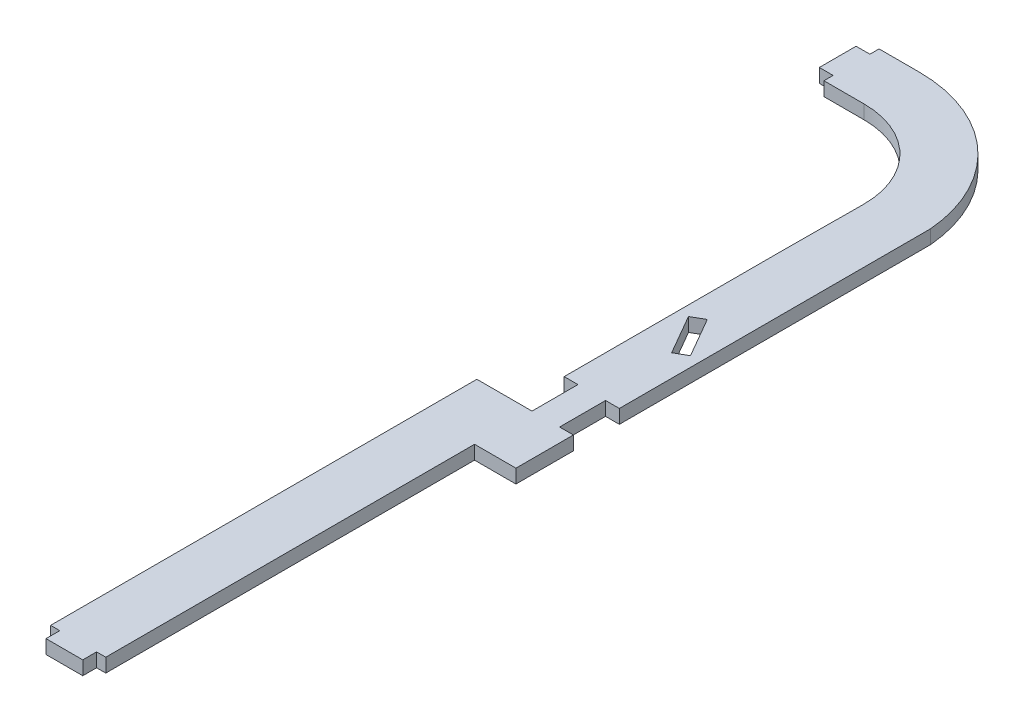
from build123d import *

# Parameters (mm, degrees)
SALIENTE_EXTRUIR1_DEPTH = 3


with BuildPart() as part:
    # Croquis1 → Saliente-Extruir1 (new body)
    with BuildSketch(Plane(origin=(0, 0, 0), x_dir=(1, 0, 0), z_dir=(0, 1, 0))):
        with BuildLine():
            Line((34.51, 4), (34.51, 0))
            Line((34.51, 0), (37.51, 0))
            Line((37.51, 0), (37.51, -2))
            Line((37.51, -2), (46.251262658, -2))
            ThreePointArc((46.251262658, -2), (59.584248365, -7.522703507), (65.106951872, -20.855689213))
            ThreePointArc((65.106951872, -20.855689213), (65.106606786, -20.969766147), (65.105571541, -21.083838906))
            Line((65.105571541, -21.083838906), (65, -38.533358743))
            Line((65, -38.533358743), (65, -86))
            Line((65, -86), (68, -86))
            Line((68, -86), (68, -96))
            Line((68, -96), (65, -96))
            Line((65, -96), (56, -96))
            Line((56, -96), (56, -188.736951872))
            Line((56, -188.736951872), (58, -188.736951872))
            Line((58, -188.736951872), (58, -191.736951872))
            Line((58, -191.736951872), (66, -191.736951872))
            Line((66, -191.736951872), (66, -188.736951872))
            Line((66, -188.736951872), (68, -188.736951872))
            Line((68, -188.736951872), (68, -108.5))
            Line((68, -108.5), (77, -108.5))
            Line((77, -108.5), (77, -96))
            Line((77, -96), (74, -96))
            Line((74, -96), (74, -86))
            Line((74, -86), (77, -86))
            Line((77, -86), (77, -64.74))
            Line((77, -64.74), (77, -38.533358743))
            Line((77, -38.533358743), (77, -23.422537226))
            Line((77, -23.422537226), (77, -18.2888412))
            ThreePointArc((77, -18.2888412), (67.142309691, 1.851968321), (46.251262658, 10))
            Line((46.251262658, 10), (37.51, 10))
            Line((37.51, 10), (37.51, 8))
            Line((37.51, 8), (34.51, 8))
            Line((34.51, 8), (34.51, 4))
        make_face()
        Polygon((67.200961894, -61.159872981), (69.799038106, -59.659872981), (74.799038106, -68.320127019), (72.200961894, -69.820127019), align=None, mode=Mode.SUBTRACT)
    extrude(amount=SALIENTE_EXTRUIR1_DEPTH)


solid = part.part
